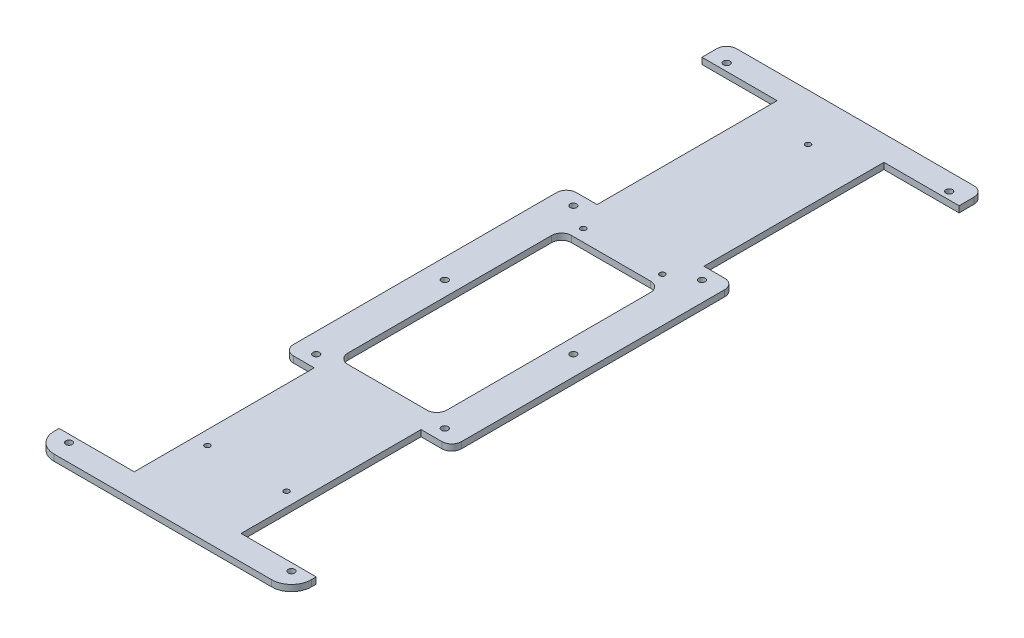
from build123d import *

# Parameters (mm, degrees)
BOSS_EXTRUDE1_DEPTH = 3.175
FILLET1_R           = 10
FILLET2_R           = 5
SKETCH2_R           = 1.65
CUT_EXTRUDE1_DEPTH  = 374.376593569
SKETCH3_R           = 1.65
CUT_EXTRUDE2_DEPTH  = 374.376593569
SKETCH4_R           = 1.65
CUT_EXTRUDE3_DEPTH  = 374.376593569
SKETCH5_R           = 1.35
CUT_EXTRUDE4_DEPTH  = 10
SKETCH6_W           = 50
SKETCH6_H           = 113
CUT_EXTRUDE5_DEPTH  = 10
FILLET4_R           = 5


with BuildPart() as part:
    # Sketch1 → Boss-Extrude1 (new body)
    with BuildSketch(Plane(origin=(0, 0, 0), x_dir=(1, 0, 0), z_dir=(0, 1, 0))):
        Polygon((0, 0), (130, 0), (130, 12.5), (92, 12.5), (92, 103.5), (107.5, 103.5), (107.5, 246.5), (92, 246.5), (92, 337.5), (130, 337.5), (130, 350), (0, 350), (0, 337.5), (38, 337.5), (38, 246.5), (22.5, 246.5), (22.5, 103.5), (38, 103.5), (38, 12.5), (0, 12.5), align=None)
    extrude(amount=BOSS_EXTRUDE1_DEPTH)

    # Fillet1
    fillet1_edges = [part.edges().sort_by_distance(p)[0] for p in [
        (130, 1.5875, 0),
        (0, 1.5875, 0),
    ]]
    fillet(fillet1_edges, radius=FILLET1_R)

    # Fillet2
    fillet2_edges = [part.edges().sort_by_distance(p)[0] for p in [
        (0, 1.5875, -350),
        (130, 1.5875, -350),
        (107.5, 1.5875, -246.5),
        (107.5, 1.5875, -103.5),
        (22.5, 1.5875, -103.5),
        (22.5, 1.5875, -246.5),
    ]]
    fillet(fillet2_edges, radius=FILLET2_R)

    # Sketch2 → Cut-Extrude1 (cut, through all)
    with BuildSketch(Plane(origin=(0, 3.175, 0), x_dir=(1, 0, 0), z_dir=(0, 1, 0))):
        with Locations((32.5, 240)):
            Circle(SKETCH2_R)
        with Locations((32.5, 175)):
            Circle(SKETCH2_R)
        with Locations((32.5, 110)):
            Circle(SKETCH2_R)
        with Locations((97.5, 110)):
            Circle(SKETCH2_R)
        with Locations((97.5, 175)):
            Circle(SKETCH2_R)
        with Locations((97.5, 240)):
            Circle(SKETCH2_R)
    extrude(amount=-CUT_EXTRUDE1_DEPTH, mode=Mode.SUBTRACT)

    # Sketch3 → Cut-Extrude2 (cut, through all)
    with BuildSketch(Plane(origin=(0, 3.175, 0), x_dir=(1, 0, 0), z_dir=(0, 1, 0))):
        with Locations((8.75, 8.75)):
            Circle(SKETCH3_R)
        with Locations((121.25, 8.75)):
            Circle(SKETCH3_R)
    extrude(amount=-CUT_EXTRUDE2_DEPTH, mode=Mode.SUBTRACT)

    # Sketch4 → Cut-Extrude3 (cut, through all)
    with BuildSketch(Plane(origin=(0, 3.175, 0), x_dir=(1, 0, 0), z_dir=(0, 1, 0))):
        with Locations((8.75, 341.25)):
            Circle(SKETCH4_R)
        with Locations((121.25, 341.25)):
            Circle(SKETCH4_R)
    extrude(amount=-CUT_EXTRUDE3_DEPTH, mode=Mode.SUBTRACT)

    # Sketch5 → Cut-Extrude4 (cut)
    with BuildSketch(Plane(origin=(0, 3.175, 0), x_dir=(1, 0, 0), z_dir=(0, 1, 0))):
        with Locations((45, 42.5)):
            Circle(SKETCH5_R)
        with Locations((85, 42.5)):
            Circle(SKETCH5_R)
        with Locations((45, 232.5)):
            Circle(SKETCH5_R)
        with Locations((85, 232.5)):
            Circle(SKETCH5_R)
        with Locations((65, 326.15)):
            Circle(SKETCH5_R)
    extrude(amount=-CUT_EXTRUDE4_DEPTH, mode=Mode.SUBTRACT)

    # Sketch6 → Cut-Extrude5 (cut)
    with BuildSketch(Plane(origin=(0, 3.175, 0), x_dir=(1, 0, 0), z_dir=(0, 1, 0))):
        with Locations((65, 170)):
            Rectangle(SKETCH6_W, SKETCH6_H)
    extrude(amount=-CUT_EXTRUDE5_DEPTH, mode=Mode.SUBTRACT)

    # Fillet4
    fillet4_edges = [part.edges().sort_by_distance(p)[0] for p in [
        (90, 1.5875, -113.5),
        (40, 1.5875, -113.5),
        (90, 1.5875, -226.5),
        (40, 1.5875, -226.5),
    ]]
    fillet(fillet4_edges, radius=FILLET4_R)


solid = part.part
